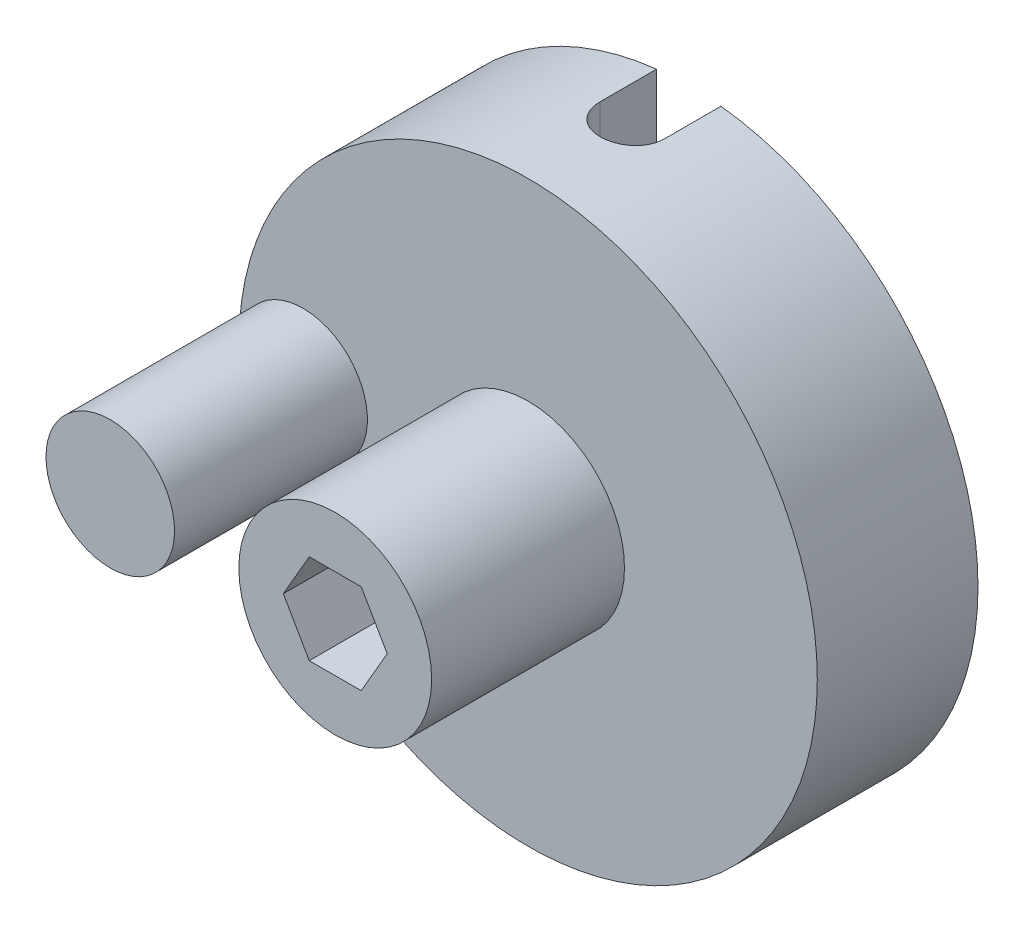
from build123d import *

# Parameters (mm, degrees)
SKETCH1_R           = 9
BOSS_EXTRUDE1_DEPTH = 5
SKETCH2_R           = 3
SKETCH2_R_2         = 2
BOSS_EXTRUDE2_DEPTH = 6
CUT_EXTRUDE1_DEPTH  = 17.822603841
CUT_EXTRUDE2_DEPTH  = 3
CUT_EXTRUDE3_DEPTH  = 8


with BuildPart() as part:
    # Sketch1 → Boss-Extrude1 (new body)
    with BuildSketch(Plane.XY):
        Circle(SKETCH1_R)
    extrude(amount=BOSS_EXTRUDE1_DEPTH)

    # Sketch2 → Boss-Extrude2 (add)
    with BuildSketch(Plane.XY.offset(5)):
        Circle(SKETCH2_R)
        with Locations((-7, 0)):
            Circle(SKETCH2_R_2)
    extrude(amount=BOSS_EXTRUDE2_DEPTH)

    # Sketch3 → Cut-Extrude1 (cut, through all)
    with BuildSketch(Plane.XY.offset(11)):
        Polygon((-1.616580754, 0), (-0.808290377, -1.4), (0.808290377, -1.4), (1.616580754, 0), (0.808290377, 1.4), (-0.808290377, 1.4), align=None)
    extrude(amount=-CUT_EXTRUDE1_DEPTH, mode=Mode.SUBTRACT)

    # Sketch4 → Cut-Extrude2 (cut)
    with BuildSketch(Plane(origin=(0, 0, 0), x_dir=(-1, 0, 0), z_dir=(0, 0, -1))):
        Polygon((-4.099186911, 0), (-2.049593456, -3.55), (2.049593456, -3.55), (4.099186911, 0), (2.049593456, 3.55), (-2.049593456, 3.55), align=None)
    extrude(amount=-CUT_EXTRUDE2_DEPTH, mode=Mode.SUBTRACT)

    # Sketch5 → Cut-Extrude3 (cut)
    with BuildSketch(Plane.XZ.offset(-3.55)):
        with BuildLine():
            Line((1, 1.756249669), (1, -1.040433474))
            Line((1, -1.040433474), (-1, -1.040433474))
            Line((-1, -1.040433474), (-1, 1.756249669))
            ThreePointArc((-1, 1.756249669), (0, 2.756249669), (1, 1.756249669))
        make_face()
    extrude(amount=-CUT_EXTRUDE3_DEPTH, mode=Mode.SUBTRACT)


solid = part.part
